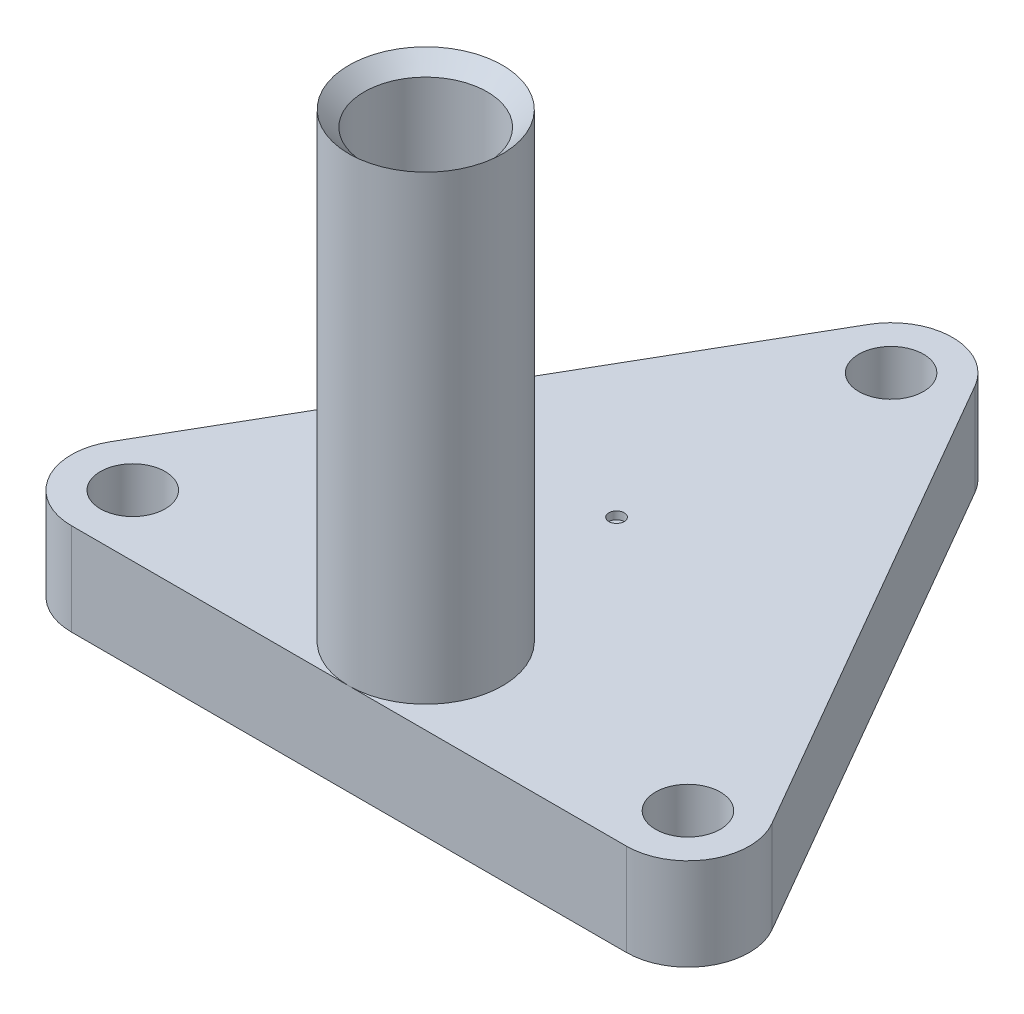
from build123d import *

# Parameters (mm, degrees)
SKETCH1_R           = 1.054
BOSS_EXTRUDE1_DEPTH = 3
SKETCH2_R           = 0.8
CUT_EXTRUDE1_DEPTH  = 23.736281859
SKETCH3_R           = 2.5
BOSS_EXTRUDE2_DEPTH = 15
CUT_EXTRUDE2_REACH  = 29.073
SKETCH4_R           = 2
CHAMFER1_SIZE       = 2
CHAMFER1_SIZE2      = 0.727940469
CHAMFER2_SIZE       = 0.5
SKETCH5_R           = 0.25
CUT_EXTRUDE3_DEPTH  = 0.25


with BuildPart() as part:
    # Sketch1 → Boss-Extrude1 (new body)
    with BuildSketch(Plane(origin=(0, 0, 0), x_dir=(1, 0, 0), z_dir=(0, 1, 0))):
        with BuildLine():
            Line((0, 0), (9.035898385, 0))
            ThreePointArc((9.035898385, 0), (10.767949192, 1), (10.767949192, 3))
            Line((10.767949192, 3), (1.732050808, 18.650635095))
            ThreePointArc((1.732050808, 18.650635095), (0, 19.650635095), (-1.732050808, 18.650635095))
            Line((-1.732050808, 18.650635095), (-10.767949192, 3))
            ThreePointArc((-10.767949192, 3), (-10.767949192, 1), (-9.035898385, 0))
            Line((-9.035898385, 0), (0, 0))
        make_face()
        with Locations(Location((0, 17.650635095, 0), (0, 0, 270))):
            Circle(SKETCH1_R, mode=Mode.SUBTRACT)
        with Locations(Location((-9.035898385, 2, 0), (0, 0, 270))):
            Circle(SKETCH1_R, mode=Mode.SUBTRACT)
        with Locations(Location((9.035898385, 2, 0), (0, 0, 270))):
            Circle(SKETCH1_R, mode=Mode.SUBTRACT)
    extrude(amount=BOSS_EXTRUDE1_DEPTH)

    # Sketch2 → Cut-Extrude1 (cut, through all)
    with BuildSketch(Plane(origin=(0, 3, 0), x_dir=(1, 0, 0), z_dir=(0, 1, 0))):
        with Locations(Location((0, 2.5, 0), (0, 0, 270))):
            Circle(SKETCH2_R)
    extrude(amount=-CUT_EXTRUDE1_DEPTH, mode=Mode.SUBTRACT)

    # Sketch3 → Boss-Extrude2 (add)
    with BuildSketch(Plane(origin=(0, 3, 0), x_dir=(1, 0, 0), z_dir=(0, 1, 0))):
        with Locations(Location((0, 2.5, 0), (0, 0, 270))):
            Circle(SKETCH3_R)
    extrude(amount=BOSS_EXTRUDE2_DEPTH)

    # Sketch4 → Cut-Extrude2 (cut, up to next)
    with BuildSketch(Plane(origin=(0, 3, 0), x_dir=(1, 0, 0), z_dir=(0, 1, 0)), mode=Mode.PRIVATE) as cut_extrude2_sk1:
        with Locations(Location((0, 2.5, 0), (0, 0, 270))):
            Circle(SKETCH4_R)
    cut_extrude2_tool1 = extrude(cut_extrude2_sk1.sketch, amount=CUT_EXTRUDE2_REACH, mode=Mode.PRIVATE) & part.part
    add(cut_extrude2_tool1.solids().sort_by_distance((0, 3, -2.5))[0], mode=Mode.SUBTRACT)

    # Chamfer1
    chamfer1_edges = [part.edges().sort_by_distance(p)[0] for p in [
        (0, 3, -4.5),
    ]]
    chamfer1_side = [part.faces().sort_by_distance(p)[0] for p in [
        (0, 10.5, -4.5),
    ]]
    chamfer(chamfer1_edges, length=CHAMFER1_SIZE, length2=CHAMFER1_SIZE2, reference=chamfer1_side[0])

    # Chamfer2
    chamfer2_edges = [part.edges().sort_by_distance(p)[0] for p in [
        (0, 18, -4.5),
    ]]
    chamfer(chamfer2_edges, length=CHAMFER2_SIZE - 0.0001)  # a hair under: the kernel refuses the full size

    # Sketch5 → Cut-Extrude3 (cut)
    with BuildSketch(Plane(origin=(0, 3, 0), x_dir=(1, 0, 0), z_dir=(0, 1, 0))):
        with Locations(Location((-0.400704282, 9.113083691, 0), (0, 0, 270))):
            Circle(SKETCH5_R)
    extrude(amount=-CUT_EXTRUDE3_DEPTH, mode=Mode.SUBTRACT)


solid = part.part
